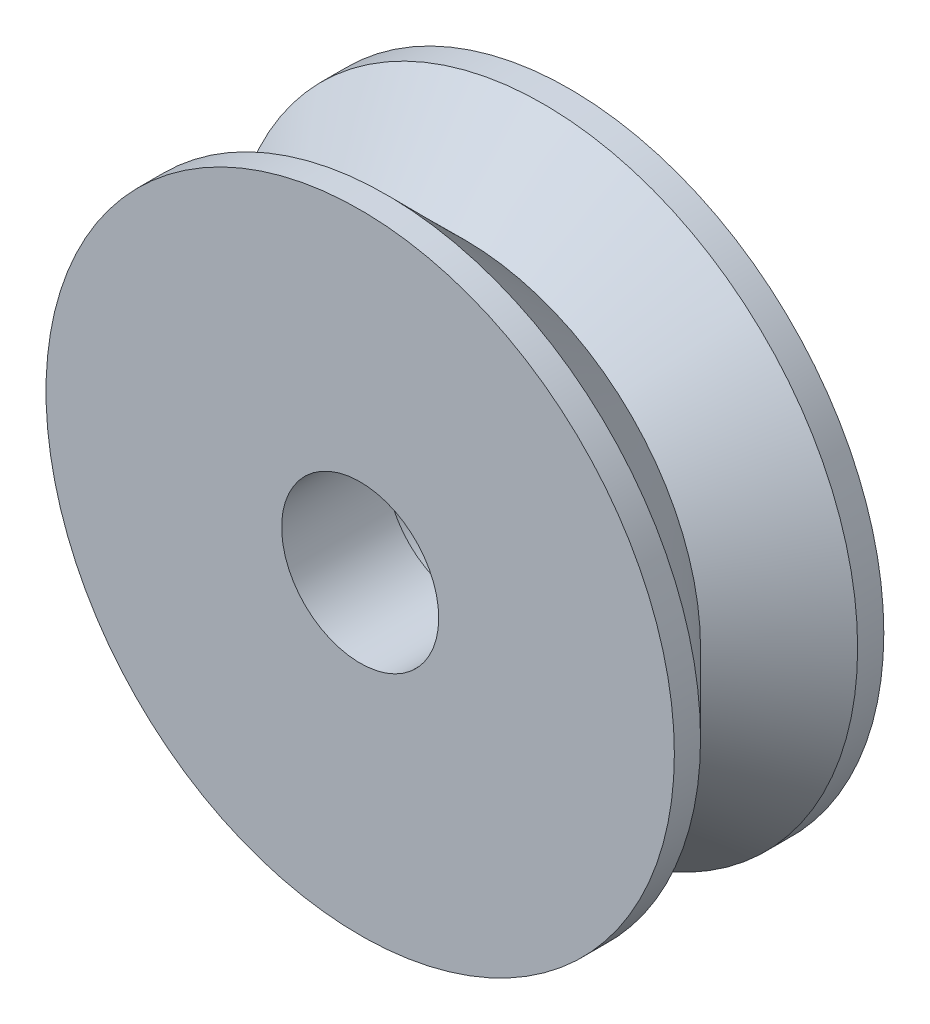
from build123d import *

# Parameters (mm, degrees)
SKETCH1_R           = 6
SKETCH1_R_2         = 1.7
BOSS_EXTRUDE1_DEPTH = 2
CHAMFER1_SIZE       = 1.5
SKETCH2_R           = 6
SKETCH2_R_2         = 1.5
BOSS_EXTRUDE2_DEPTH = 2
CHAMFER2_SIZE       = 1.5


with BuildPart() as part:
    # Sketch1 → Boss-Extrude1 (new body)
    with BuildSketch(Plane.XY):
        Circle(SKETCH1_R)
        Circle(SKETCH1_R_2, mode=Mode.SUBTRACT)
    extrude(amount=BOSS_EXTRUDE1_DEPTH)

    # Chamfer1
    chamfer1_edges = [part.edges().sort_by_distance(p)[0] for p in [
        (-6, 0, 2),
    ]]
    chamfer(chamfer1_edges, length=CHAMFER1_SIZE)

    # Sketch2 → Boss-Extrude2 (add)
    with BuildSketch(Plane.XY.offset(2)):
        Circle(SKETCH2_R)
        Circle(SKETCH2_R_2, mode=Mode.SUBTRACT)
    extrude(amount=BOSS_EXTRUDE2_DEPTH)

    # Chamfer2
    chamfer2_edges = [part.edges().sort_by_distance(p)[0] for p in [
        (-6, 0, 2),
    ]]
    chamfer(chamfer2_edges, length=CHAMFER2_SIZE - 0.0001)  # a hair under: the kernel refuses the full size


solid = part.part
